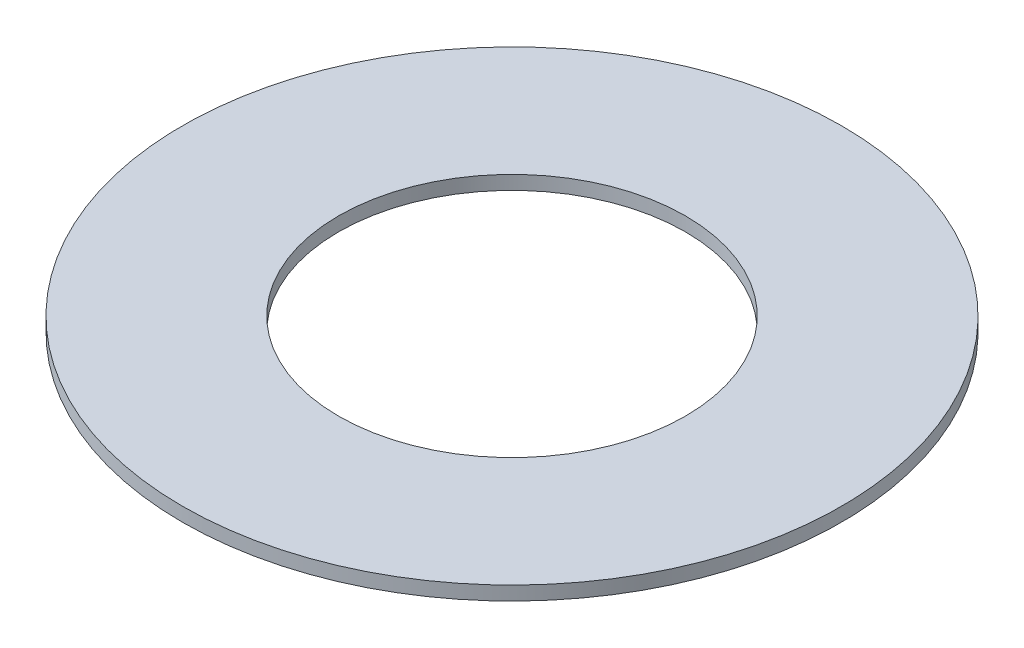
from build123d import *

# Parameters (mm, degrees)
SKETCH1_R           = 95
BOSS_EXTRUDE1_DEPTH = 4
SKETCH2_R           = 50
CUT_EXTRUDE1_DEPTH  = 135.40982107


with BuildPart() as part:
    # Sketch1 → Boss-Extrude1 (new body)
    with BuildSketch(Plane(origin=(0, 0, 0), x_dir=(1, 0, 0), z_dir=(0, 1, 0))):
        Circle(SKETCH1_R)
    extrude(amount=BOSS_EXTRUDE1_DEPTH)

    # Sketch2 → Cut-Extrude1 (cut, through all)
    with BuildSketch(Plane(origin=(0, 0, 0), x_dir=(1, 0, 0), z_dir=(0, 1, 0))):
        Circle(SKETCH2_R)
    extrude(amount=CUT_EXTRUDE1_DEPTH, mode=Mode.SUBTRACT)


solid = part.part
